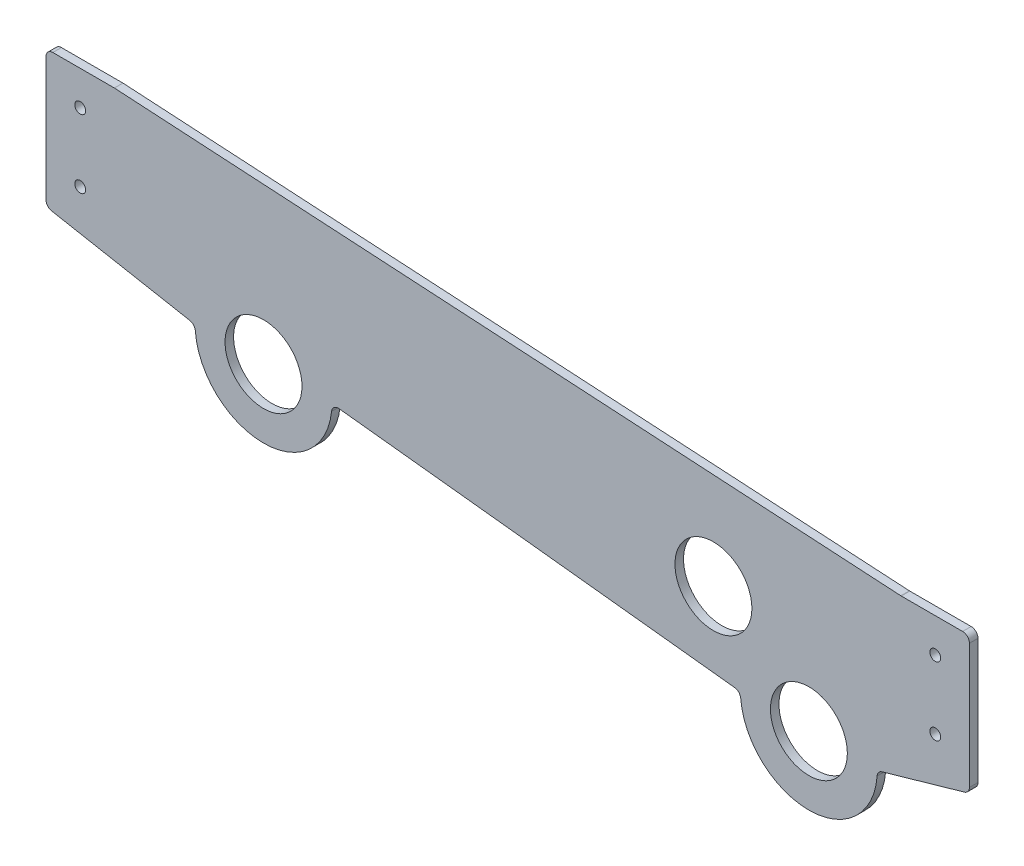
from build123d import *

# Parameters (mm, degrees)
SKETCH1_R           = 14.2875
SKETCH1_R_2         = 2.0193
BOSS_EXTRUDE1_DEPTH = 3.175
FILLET1_R           = 2.54
SKETCH2_R           = 14.2875
CUT_EXTRUDE1_DEPTH  = 238.443914509


with BuildPart() as part:
    # Sketch1 → Boss-Extrude1 (new body)
    with BuildSketch(Plane.XY):
        with BuildLine():
            Line((-146.05, 164.23894), (-171.45, 164.23894))
            Line((-171.45, 164.23894), (-171.45, 113.43894))
            Line((-171.45, 113.43894), (-116.081416722, 103.131947821))
            ThreePointArc((-116.081416722, 103.131947821), (-90.681416722, 77.731947821), (-65.281416722, 103.131947821))
            Line((-65.281416722, 103.131947821), (86.42489431, 86.355953292))
            ThreePointArc((86.42489431, 86.355953292), (111.82489431, 60.955953292), (137.22489431, 86.355953292))
            Line((137.22489431, 86.355953292), (171.45, 96.16694))
            Line((171.45, 96.16694), (171.45, 146.96694))
            Line((171.45, 146.96694), (146.05, 146.96694))
            Line((146.05, 146.96694), (-146.05, 164.23894))
        make_face()
        with Locations((-90.681416722, 103.131947821)):
            Circle(SKETCH1_R, mode=Mode.SUBTRACT)
        with Locations((111.82489431, 86.355953292)):
            Circle(SKETCH1_R, mode=Mode.SUBTRACT)
        with Locations((-158.75, 151.53894)):
            Circle(SKETCH1_R_2, mode=Mode.SUBTRACT)
        with Locations((158.75, 134.26694)):
            Circle(SKETCH1_R_2, mode=Mode.SUBTRACT)
        with Locations((158.75, 108.86694)):
            Circle(SKETCH1_R_2, mode=Mode.SUBTRACT)
        with Locations((-158.75, 126.13894)):
            Circle(SKETCH1_R_2, mode=Mode.SUBTRACT)
    extrude(amount=BOSS_EXTRUDE1_DEPTH)

    # Fillet1
    # the kernel refuses this fillet: 2.54 mm, written as the material it adds along each edge
    with BuildSketch(Plane(origin=(-65.281416722, 103.131947821, 0), x_dir=(-0.05054020357066893, -0.9987220273044123, 0), z_dir=(0, 0, 1))) as fillet1_piece_1:
        with BuildLine():
            CenterArc((2.695814458, 2.536753949), FILLET1_R, 176.586727967, 90.516297483)
            Line((0.160320257, 2.687979466), (0, 0))
            ThreePointArc((0, 0), (1.283721171, 0.032460506), (2.567442341, 0))
        make_face()
    extrude(amount=3.175)
    with BuildSketch(Plane(origin=(-116.081416722, 103.131947821, 0), x_dir=(-0.983111332758604, 0.1830084899713721, 0), z_dir=(0, 0, 1))) as fillet1_piece_2:
        with BuildLine():
            CenterArc((2.028421781, 2.54), FILLET1_R, 194.908754381, 75.091245619)
            ThreePointArc((-0.42607364, 1.886507669), (-0.195074838, 0.947310604), (0, 0))
            Line((0, 0), (2.028421781, 0))
        make_face()
    extrude(amount=3.175)
    with BuildSketch(Plane(origin=(146.05, 146.96694, 0), x_dir=(1, 0, 0), z_dir=(0, 0, 1))) as fillet1_piece_3:
        with BuildLine():
            CenterArc((FILLET1_R * 0.0295394194537, FILLET1_R), FILLET1_R, 266.616015906, 3.383984094)
            Line((-FILLET1_R * 0.0294879135427, FILLET1_R * 0.00174363314861), (0, 0))
            Line((0, 0), (FILLET1_R * 0.0295394194537, 0))
        make_face()
    extrude(amount=3.175)
    with BuildSketch(Plane(origin=(137.22489431, 86.355953292, 0), x_dir=(0.9612833075503766, 0.275561976014486, 0), z_dir=(0, 0, 1))) as fillet1_piece_4:
        with BuildLine():
            CenterArc((1.844513026, -2.54), FILLET1_R, 90, 70.036589556)
            ThreePointArc((-0.542860523, -1.672793255), (-0.256948075, -0.841096436), (0, 0))
            Line((0, 0), (1.844513026, 0))
        make_face()
    extrude(amount=3.175)
    with BuildSketch(Plane(origin=(86.42489431, 86.355953292, 0), x_dir=(-0.9939413150469867, 0.10991206595577574, 0), z_dir=(0, 0, 1))) as fillet1_piece_5:
        with BuildLine():
            CenterArc((2.180444633, 2.54), FILLET1_R, 191.001176441, 78.998823559)
            ThreePointArc((-0.312878461, 2.055293957), (-0.13540237, 1.03084943), (0, 0))
            Line((0, 0), (2.180444633, 0))
        make_face()
    extrude(amount=3.175)
    # the kernel refuses this fillet: 2.54 mm, written as the material it takes off along each edge
    with BuildSketch(Plane(origin=(-171.45, 113.43894, -5.277017888), x_dir=(0, 1, 0), z_dir=(0, 0, 1))) as fillet1_2_piece_1:
        with BuildLine():
            CenterArc((FILLET1_R * 0.831026439026, -FILLET1_R), FILLET1_R, 90, 79.454954882)
            Line((-FILLET1_R * 0.152084893732, -FILLET1_R * 0.816991510029), (0, 0))
            Line((0, 0), (FILLET1_R * 0.831026439026, 0))
        make_face()
    extrude(amount=13.729035776, mode=Mode.SUBTRACT)
    with BuildSketch(Plane(origin=(-171.45, 164.23894, -6.35), x_dir=(1, 0, 0), z_dir=(0, 0, 1)), Plane(origin=(171.45, 146.96694, -6.35), x_dir=(0, -1, 0), z_dir=(0, 0, 1))) as fillet1_2_piece_2:
        with BuildLine():
            CenterArc((FILLET1_R, -FILLET1_R), FILLET1_R, 90, 90)
            Line((0, -FILLET1_R), (0, 0))
            Line((0, 0), (FILLET1_R, 0))
        make_face()
    extrude(amount=15.875, mode=Mode.SUBTRACT)
    with BuildSketch(Plane(origin=(171.45, 96.16694, -4.78545858), x_dir=(-0.9612833075503753, -0.2755619760144905, 0), z_dir=(0, 0, 1))) as fillet1_2_piece_3:
        with BuildLine():
            CenterArc((FILLET1_R * 0.753615524472, -FILLET1_R), FILLET1_R, 90, 74.004492945)
            Line((-FILLET1_R * 0.207667783079, -FILLET1_R * 0.724438023986), (0, 0))
            Line((0, 0), (FILLET1_R * 0.753615524472, 0))
        make_face()
    extrude(amount=12.745917161, mode=Mode.SUBTRACT)

    # Sketch2 → Cut-Extrude1 (cut, through all)
    with BuildSketch(Plane.XY.offset(3.175)):
        with Locations((76.380709606, 115.23549918)):
            Circle(SKETCH2_R)
    extrude(amount=-CUT_EXTRUDE1_DEPTH, mode=Mode.SUBTRACT)


solid = part.part
